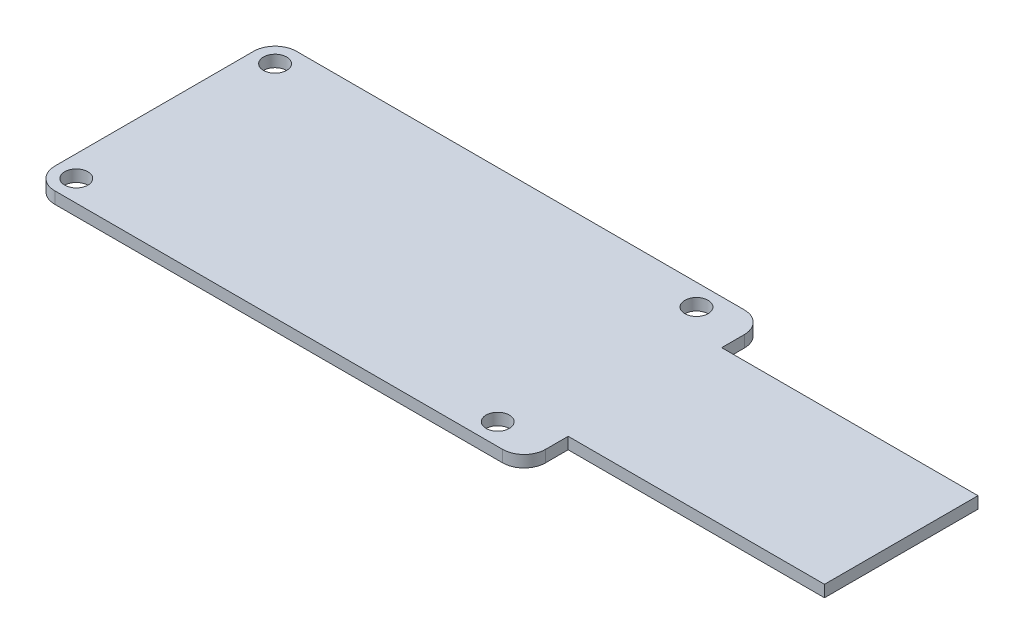
from build123d import *

# Parameters (mm, degrees)
SKETCH1_R           = 1.5875
BOSS_EXTRUDE1_DEPTH = 1.6


with BuildPart() as part:
    # Sketch1 → Boss-Extrude1 (new body)
    with BuildSketch(Plane(origin=(0, 0, 0), x_dir=(1, 0, 0), z_dir=(0, 1, 0))):
        with BuildLine():
            Line((-33.5, 13.57), (-33.5, -13.57))
            ThreePointArc((-33.5, -13.57), (-32.641822869, -15.641822869), (-30.57, -16.5))
            Line((-30.57, -16.5), (30.57, -16.5))
            ThreePointArc((30.57, -16.5), (32.641822869, -15.641822869), (33.5, -13.57))
            Line((33.5, -13.57), (33.5, -10.48))
            Line((33.5, -10.48), (68.5, -10.48))
            Line((68.5, -10.48), (68.5, 10.48))
            Line((68.5, 10.48), (33.5, 10.48))
            Line((33.5, 10.48), (33.5, 13.57))
            ThreePointArc((33.5, 13.57), (32.641822869, 15.641822869), (30.57, 16.5))
            Line((30.57, 16.5), (-30.57, 16.5))
            ThreePointArc((-30.57, 16.5), (-32.641822869, 15.641822869), (-33.5, 13.57))
        make_face()
        with Locations((-30.57, 13.57)):
            Circle(SKETCH1_R, mode=Mode.SUBTRACT)
        with Locations((26.97, 13.57)):
            Circle(SKETCH1_R, mode=Mode.SUBTRACT)
        with Locations((26.97, -13.57)):
            Circle(SKETCH1_R, mode=Mode.SUBTRACT)
        with Locations((-30.57, -13.57)):
            Circle(SKETCH1_R, mode=Mode.SUBTRACT)
    extrude(amount=BOSS_EXTRUDE1_DEPTH)


solid = part.part
